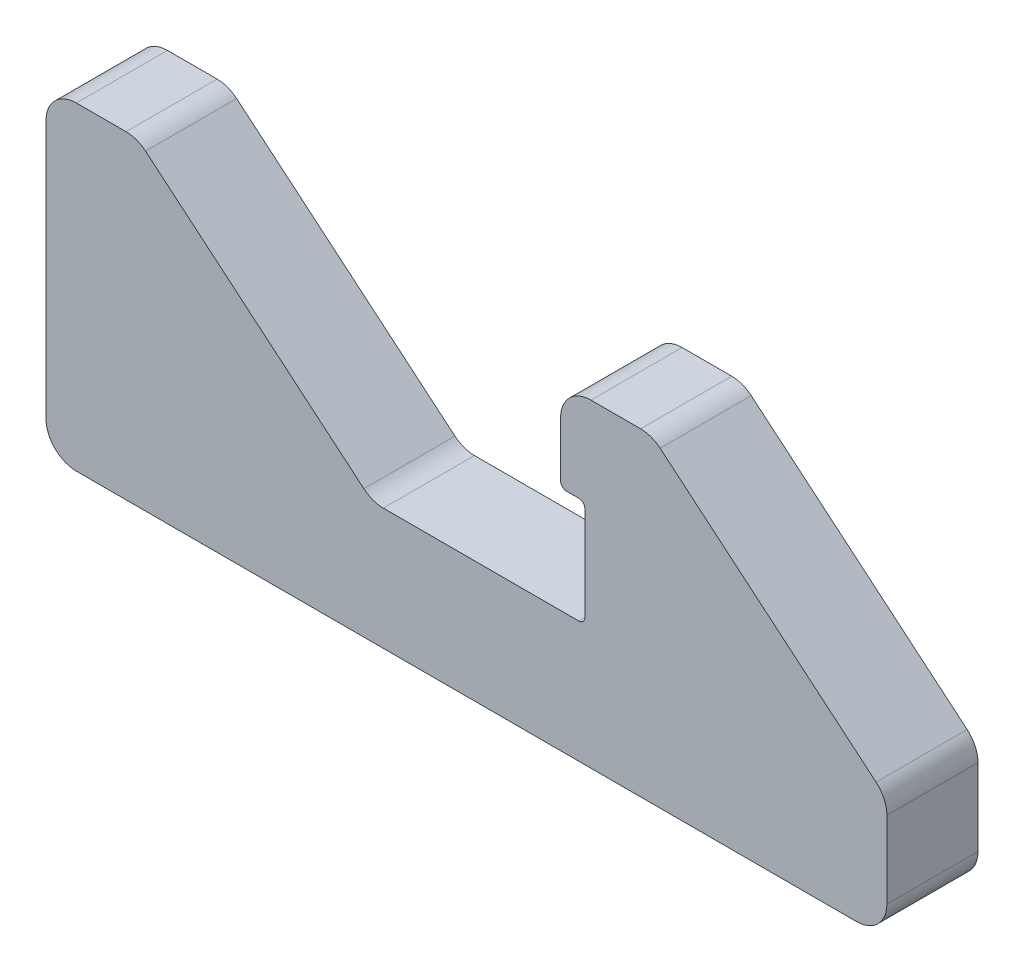
from build123d import *

# Parameters (mm, degrees)
BOSS_EXTRUDE1_DEPTH = 30
FILLET1_R           = 10
FILLET2_R           = 2


with BuildPart() as part:
    # Sketch1 → Boss-Extrude1 (new body)
    with BuildSketch(Plane.XY):
        Polygon((0, 0), (0, 105), (30, 105), (107.463983519, 40), (177.463983519, 40), (177.463983519, 75), (169.463983519, 75), (169.463983519, 105), (199.463983519, 105), (276.927967037, 40), (276.927967037, 0), align=None)
    extrude(amount=BOSS_EXTRUDE1_DEPTH)

    # Fillet1
    fillet1_edges = [part.edges().sort_by_distance(p)[0] for p in [
        (276.927967037, 0, 15),
        (0, 0, 15),
        (0, 105, 15),
        (30, 105, 15),
        (107.463983519, 40, 15),
        (276.927967037, 40, 15),
        (199.463983519, 105, 15),
        (169.463983519, 105, 15),
    ]]
    fillet(fillet1_edges, radius=FILLET1_R)

    # Fillet2
    fillet2_edges = [part.edges().sort_by_distance(p)[0] for p in [
        (177.463983519, 40, 15),
        (177.463983519, 75, 15),
        (169.463983519, 75, 15),
    ]]
    fillet(fillet2_edges, radius=FILLET2_R)


solid = part.part
